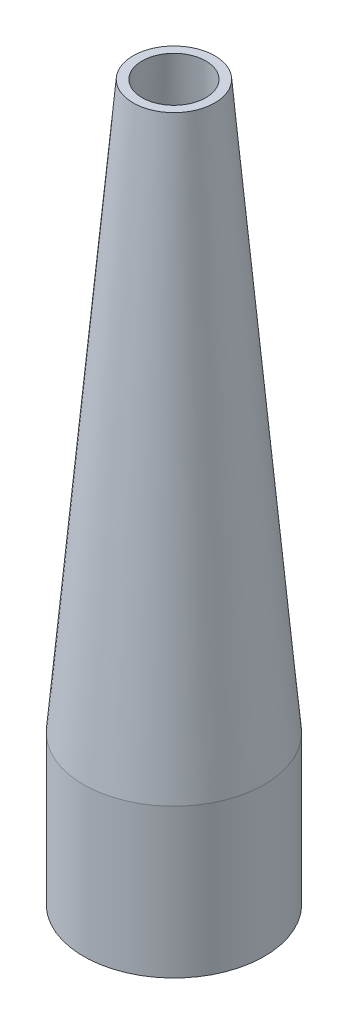
from build123d import *


with BuildPart() as part:
    # Sketch1 → Revolve1 (revolve)
    with BuildSketch(Plane.XY):
        Polygon((12.202187507, 49.163451631), (9.525, 49.163451631), (24.310312493, -119.83344348), (24.310312493, -164.28344348), (26.9875, -164.28344348), (26.9875, -119.83344348), align=None)
    revolve(axis=Axis((0, 0, 0), (0, 1, 0)))


solid = part.part
